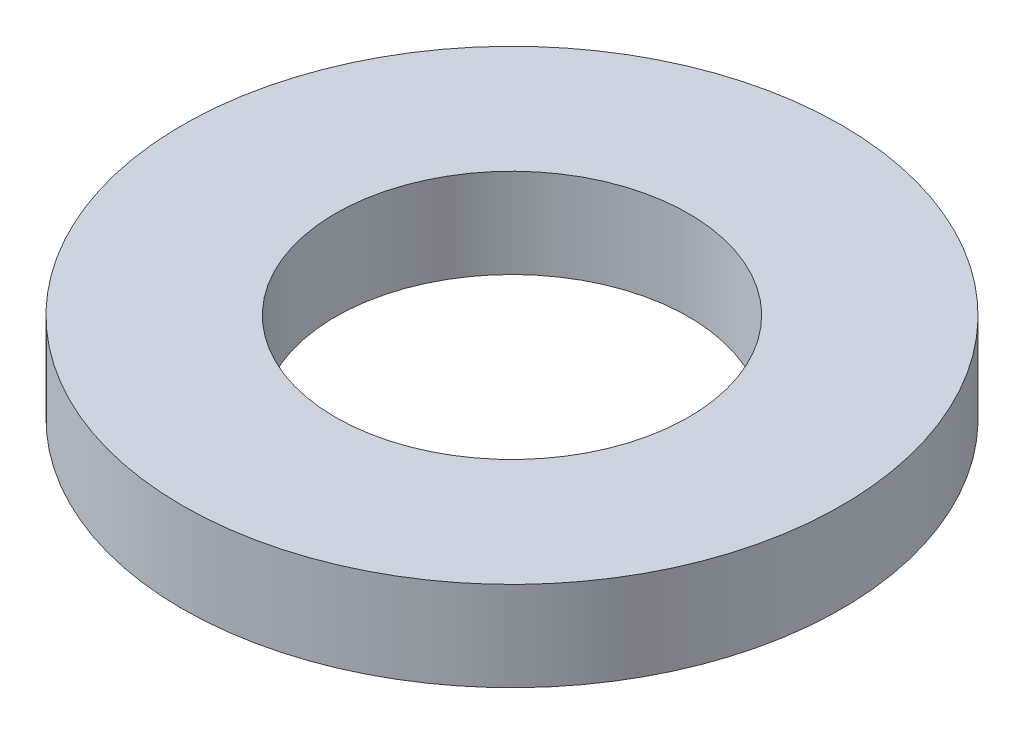
from build123d import *

# Parameters (mm, degrees)
SKETCH1_R           = 70
BOSS_EXTRUDE1_DEPTH = 19
SKETCH2_R           = 37.5
CUT_EXTRUDE1_DEPTH  = 101.801785698


with BuildPart() as part:
    # Sketch1 → Boss-Extrude1 (new body)
    with BuildSketch(Plane(origin=(0, 0, 0), x_dir=(1, 0, 0), z_dir=(0, 1, 0))):
        Circle(SKETCH1_R)
    extrude(amount=BOSS_EXTRUDE1_DEPTH)

    # Sketch2 → Cut-Extrude1 (cut, through all)
    with BuildSketch(Plane(origin=(0, 0, 0), x_dir=(1, 0, 0), z_dir=(0, 1, 0))):
        Circle(SKETCH2_R)
    extrude(amount=CUT_EXTRUDE1_DEPTH, mode=Mode.SUBTRACT)


solid = part.part
